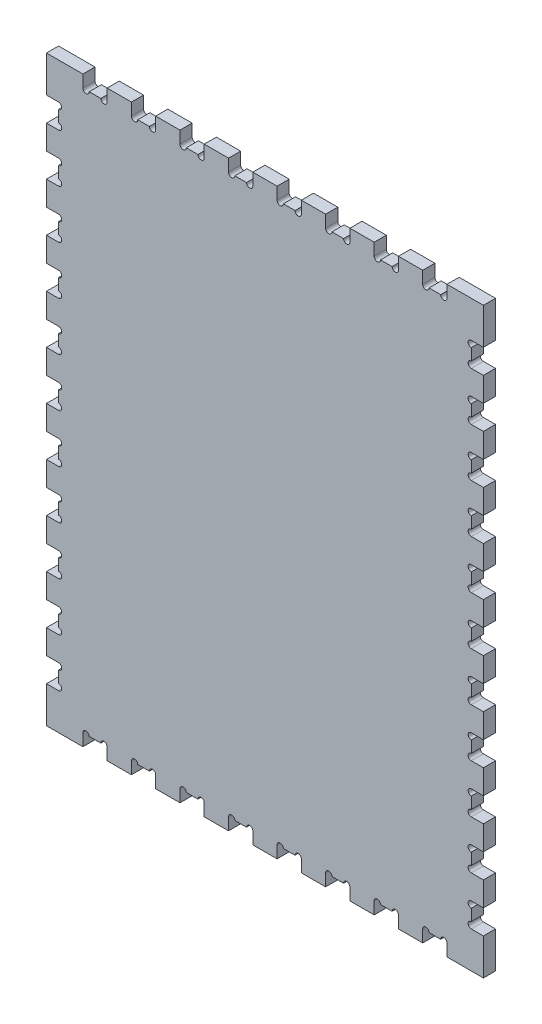
from build123d import *

# Parameters (mm, degrees)
SKETCH1_W             = 457.2
SKETCH1_H             = 609.6
BOSS_EXTRUDE1_DEPTH   = 12.7
CUT_EXTRUDE1_DEPTH    = 382.211607903
LPATTERN1_COUNT       = 8
LPATTERN1_PITCH       = 50.8
CUT_EXTRUDE2_DEPTH    = 382.211607903
LPATTERN2_COUNT       = 11
LPATTERN2_PITCH       = 50.8
MIRROR1_COPY_1_DEPTH  = 382.211607903
MIRROR1_COPY_2_DEPTH  = 382.211607903
MIRROR1_COPY_3_DEPTH  = 382.211607903
MIRROR1_COPY_4_DEPTH  = 382.211607903
MIRROR1_COPY_5_DEPTH  = 382.211607903
MIRROR1_COPY_6_DEPTH  = 382.211607903
MIRROR1_COPY_7_DEPTH  = 382.211607903
MIRROR1_COPY_8_DEPTH  = 382.211607903
MIRROR1_COPY_9_DEPTH  = 382.211607903
MIRROR1_COPY_10_DEPTH = 382.211607903
MIRROR1_COPY_11_DEPTH = 382.211607903
MIRROR2_COPY_1_DEPTH  = 382.211607903
MIRROR2_COPY_2_DEPTH  = 382.211607903
MIRROR2_COPY_3_DEPTH  = 382.211607903
MIRROR2_COPY_4_DEPTH  = 382.211607903
MIRROR2_COPY_5_DEPTH  = 382.211607903
MIRROR2_COPY_6_DEPTH  = 382.211607903
MIRROR2_COPY_7_DEPTH  = 382.211607903
MIRROR2_COPY_8_DEPTH  = 382.211607903


with BuildPart() as part:
    # Sketch1 → Boss-Extrude1 (new body)
    with BuildSketch(Plane.XY):
        Rectangle(SKETCH1_W, SKETCH1_H)
    extrude(amount=BOSS_EXTRUDE1_DEPTH)

    # Sketch2 → Cut-Extrude1 (cut, through all)
    with BuildSketch(Plane.XY.offset(12.7)):
        with BuildLine():
            Line((-165.1, 304.8), (-190.5, 304.8))
            Line((-190.5, 304.8), (-190.5, 292.1))
            ThreePointArc((-190.5, 292.1), (-187.198, 288.798), (-183.896, 292.1))
            Line((-183.896, 292.1), (-171.704, 292.1))
            ThreePointArc((-171.704, 292.1), (-168.402, 288.798), (-165.1, 292.1))
            Line((-165.1, 292.1), (-165.1, 304.8))
        make_face()
    cut_extrude1 = extrude(amount=-CUT_EXTRUDE1_DEPTH, mode=Mode.SUBTRACT)

    # LPattern1: Cut-Extrude1 ×8
    with Locations(*[(i * LPATTERN1_PITCH, 0, 0) for i in range(1, LPATTERN1_COUNT)]):
        add(cut_extrude1, mode=Mode.SUBTRACT)

    # Sketch3 → Cut-Extrude2 (cut, through all)
    with BuildSketch(Plane.XY.offset(12.7)):
        with BuildLine():
            Line((-215.9, 266.7), (-228.6, 266.7))
            Line((-228.6, 266.7), (-228.6, 241.3))
            Line((-228.6, 241.3), (-215.9, 241.3))
            ThreePointArc((-215.9, 241.3), (-212.598, 244.602), (-215.9, 247.904))
            Line((-215.9, 247.904), (-215.9, 260.096))
            ThreePointArc((-215.9, 260.096), (-212.598, 263.398), (-215.9, 266.7))
        make_face()
    cut_extrude2 = extrude(amount=-CUT_EXTRUDE2_DEPTH, mode=Mode.SUBTRACT)

    # LPattern2: Cut-Extrude2 ×11
    with Locations(*[(0, -i * LPATTERN2_PITCH, 0) for i in range(1, LPATTERN2_COUNT)]):
        add(cut_extrude2, mode=Mode.SUBTRACT)

    # Mirror1 copy 1 sketch → Mirror1 copy 1 (cut, through all)
    with BuildSketch(Plane(origin=(0, -50.8, 12.7), x_dir=(-1, 0, 0), z_dir=(0, 0, 1))):
        with BuildLine():
            Line((-215.9, -266.7), (-228.6, -266.7))
            Line((-228.6, -266.7), (-228.6, -241.3))
            Line((-228.6, -241.3), (-215.9, -241.3))
            ThreePointArc((-215.9, -241.3), (-212.598, -244.602), (-215.9, -247.904))
            Line((-215.9, -247.904), (-215.9, -260.096))
            ThreePointArc((-215.9, -260.096), (-212.598, -263.398), (-215.9, -266.7))
        make_face()
    extrude(amount=-MIRROR1_COPY_1_DEPTH, mode=Mode.SUBTRACT)

    # Mirror1 copy 2 sketch → Mirror1 copy 2 (cut, through all)
    with BuildSketch(Plane(origin=(0, -101.6, 12.7), x_dir=(-1, 0, 0), z_dir=(0, 0, 1))):
        with BuildLine():
            Line((-215.9, -266.7), (-228.6, -266.7))
            Line((-228.6, -266.7), (-228.6, -241.3))
            Line((-228.6, -241.3), (-215.9, -241.3))
            ThreePointArc((-215.9, -241.3), (-212.598, -244.602), (-215.9, -247.904))
            Line((-215.9, -247.904), (-215.9, -260.096))
            ThreePointArc((-215.9, -260.096), (-212.598, -263.398), (-215.9, -266.7))
        make_face()
    extrude(amount=-MIRROR1_COPY_2_DEPTH, mode=Mode.SUBTRACT)

    # Mirror1 copy 3 sketch → Mirror1 copy 3 (cut, through all)
    with BuildSketch(Plane(origin=(0, -152.4, 12.7), x_dir=(-1, 0, 0), z_dir=(0, 0, 1))):
        with BuildLine():
            Line((-215.9, -266.7), (-228.6, -266.7))
            Line((-228.6, -266.7), (-228.6, -241.3))
            Line((-228.6, -241.3), (-215.9, -241.3))
            ThreePointArc((-215.9, -241.3), (-212.598, -244.602), (-215.9, -247.904))
            Line((-215.9, -247.904), (-215.9, -260.096))
            ThreePointArc((-215.9, -260.096), (-212.598, -263.398), (-215.9, -266.7))
        make_face()
    extrude(amount=-MIRROR1_COPY_3_DEPTH, mode=Mode.SUBTRACT)

    # Mirror1 copy 4 sketch → Mirror1 copy 4 (cut, through all)
    with BuildSketch(Plane(origin=(0, -203.2, 12.7), x_dir=(-1, 0, 0), z_dir=(0, 0, 1))):
        with BuildLine():
            Line((-215.9, -266.7), (-228.6, -266.7))
            Line((-228.6, -266.7), (-228.6, -241.3))
            Line((-228.6, -241.3), (-215.9, -241.3))
            ThreePointArc((-215.9, -241.3), (-212.598, -244.602), (-215.9, -247.904))
            Line((-215.9, -247.904), (-215.9, -260.096))
            ThreePointArc((-215.9, -260.096), (-212.598, -263.398), (-215.9, -266.7))
        make_face()
    extrude(amount=-MIRROR1_COPY_4_DEPTH, mode=Mode.SUBTRACT)

    # Mirror1 copy 5 sketch → Mirror1 copy 5 (cut, through all)
    with BuildSketch(Plane(origin=(0, -254, 12.7), x_dir=(-1, 0, 0), z_dir=(0, 0, 1))):
        with BuildLine():
            Line((-215.9, -266.7), (-228.6, -266.7))
            Line((-228.6, -266.7), (-228.6, -241.3))
            Line((-228.6, -241.3), (-215.9, -241.3))
            ThreePointArc((-215.9, -241.3), (-212.598, -244.602), (-215.9, -247.904))
            Line((-215.9, -247.904), (-215.9, -260.096))
            ThreePointArc((-215.9, -260.096), (-212.598, -263.398), (-215.9, -266.7))
        make_face()
    extrude(amount=-MIRROR1_COPY_5_DEPTH, mode=Mode.SUBTRACT)

    # Mirror1 copy 6 sketch → Mirror1 copy 6 (cut, through all)
    with BuildSketch(Plane(origin=(0, -304.8, 12.7), x_dir=(-1, 0, 0), z_dir=(0, 0, 1))):
        with BuildLine():
            Line((-215.9, -266.7), (-228.6, -266.7))
            Line((-228.6, -266.7), (-228.6, -241.3))
            Line((-228.6, -241.3), (-215.9, -241.3))
            ThreePointArc((-215.9, -241.3), (-212.598, -244.602), (-215.9, -247.904))
            Line((-215.9, -247.904), (-215.9, -260.096))
            ThreePointArc((-215.9, -260.096), (-212.598, -263.398), (-215.9, -266.7))
        make_face()
    extrude(amount=-MIRROR1_COPY_6_DEPTH, mode=Mode.SUBTRACT)

    # Mirror1 copy 7 sketch → Mirror1 copy 7 (cut, through all)
    with BuildSketch(Plane(origin=(0, -355.6, 12.7), x_dir=(-1, 0, 0), z_dir=(0, 0, 1))):
        with BuildLine():
            Line((-215.9, -266.7), (-228.6, -266.7))
            Line((-228.6, -266.7), (-228.6, -241.3))
            Line((-228.6, -241.3), (-215.9, -241.3))
            ThreePointArc((-215.9, -241.3), (-212.598, -244.602), (-215.9, -247.904))
            Line((-215.9, -247.904), (-215.9, -260.096))
            ThreePointArc((-215.9, -260.096), (-212.598, -263.398), (-215.9, -266.7))
        make_face()
    extrude(amount=-MIRROR1_COPY_7_DEPTH, mode=Mode.SUBTRACT)

    # Mirror1 copy 8 sketch → Mirror1 copy 8 (cut, through all)
    with BuildSketch(Plane(origin=(0, -406.4, 12.7), x_dir=(-1, 0, 0), z_dir=(0, 0, 1))):
        with BuildLine():
            Line((-215.9, -266.7), (-228.6, -266.7))
            Line((-228.6, -266.7), (-228.6, -241.3))
            Line((-228.6, -241.3), (-215.9, -241.3))
            ThreePointArc((-215.9, -241.3), (-212.598, -244.602), (-215.9, -247.904))
            Line((-215.9, -247.904), (-215.9, -260.096))
            ThreePointArc((-215.9, -260.096), (-212.598, -263.398), (-215.9, -266.7))
        make_face()
    extrude(amount=-MIRROR1_COPY_8_DEPTH, mode=Mode.SUBTRACT)

    # Mirror1 copy 9 sketch → Mirror1 copy 9 (cut, through all)
    with BuildSketch(Plane(origin=(0, -457.2, 12.7), x_dir=(-1, 0, 0), z_dir=(0, 0, 1))):
        with BuildLine():
            Line((-215.9, -266.7), (-228.6, -266.7))
            Line((-228.6, -266.7), (-228.6, -241.3))
            Line((-228.6, -241.3), (-215.9, -241.3))
            ThreePointArc((-215.9, -241.3), (-212.598, -244.602), (-215.9, -247.904))
            Line((-215.9, -247.904), (-215.9, -260.096))
            ThreePointArc((-215.9, -260.096), (-212.598, -263.398), (-215.9, -266.7))
        make_face()
    extrude(amount=-MIRROR1_COPY_9_DEPTH, mode=Mode.SUBTRACT)

    # Mirror1 copy 10 sketch → Mirror1 copy 10 (cut, through all)
    with BuildSketch(Plane(origin=(0, -508, 12.7), x_dir=(-1, 0, 0), z_dir=(0, 0, 1))):
        with BuildLine():
            Line((-215.9, -266.7), (-228.6, -266.7))
            Line((-228.6, -266.7), (-228.6, -241.3))
            Line((-228.6, -241.3), (-215.9, -241.3))
            ThreePointArc((-215.9, -241.3), (-212.598, -244.602), (-215.9, -247.904))
            Line((-215.9, -247.904), (-215.9, -260.096))
            ThreePointArc((-215.9, -260.096), (-212.598, -263.398), (-215.9, -266.7))
        make_face()
    extrude(amount=-MIRROR1_COPY_10_DEPTH, mode=Mode.SUBTRACT)

    # Mirror1 copy 11 sketch → Mirror1 copy 11 (cut, through all)
    with BuildSketch(Plane(origin=(0, 0, 12.7), x_dir=(-1, 0, 0), z_dir=(0, 0, 1))):
        with BuildLine():
            Line((-215.9, -266.7), (-228.6, -266.7))
            Line((-228.6, -266.7), (-228.6, -241.3))
            Line((-228.6, -241.3), (-215.9, -241.3))
            ThreePointArc((-215.9, -241.3), (-212.598, -244.602), (-215.9, -247.904))
            Line((-215.9, -247.904), (-215.9, -260.096))
            ThreePointArc((-215.9, -260.096), (-212.598, -263.398), (-215.9, -266.7))
        make_face()
    extrude(amount=-MIRROR1_COPY_11_DEPTH, mode=Mode.SUBTRACT)

    # Mirror2 copy 1 sketch → Mirror2 copy 1 (cut, through all)
    with BuildSketch(Plane(origin=(50.8, 0, 12.7), x_dir=(1, 0, 0), z_dir=(0, 0, 1))):
        with BuildLine():
            Line((-165.1, -304.8), (-190.5, -304.8))
            Line((-190.5, -304.8), (-190.5, -292.1))
            ThreePointArc((-190.5, -292.1), (-187.198, -288.798), (-183.896, -292.1))
            Line((-183.896, -292.1), (-171.704, -292.1))
            ThreePointArc((-171.704, -292.1), (-168.402, -288.798), (-165.1, -292.1))
            Line((-165.1, -292.1), (-165.1, -304.8))
        make_face()
    extrude(amount=-MIRROR2_COPY_1_DEPTH, mode=Mode.SUBTRACT)

    # Mirror2 copy 2 sketch → Mirror2 copy 2 (cut, through all)
    with BuildSketch(Plane(origin=(101.6, 0, 12.7), x_dir=(1, 0, 0), z_dir=(0, 0, 1))):
        with BuildLine():
            Line((-165.1, -304.8), (-190.5, -304.8))
            Line((-190.5, -304.8), (-190.5, -292.1))
            ThreePointArc((-190.5, -292.1), (-187.198, -288.798), (-183.896, -292.1))
            Line((-183.896, -292.1), (-171.704, -292.1))
            ThreePointArc((-171.704, -292.1), (-168.402, -288.798), (-165.1, -292.1))
            Line((-165.1, -292.1), (-165.1, -304.8))
        make_face()
    extrude(amount=-MIRROR2_COPY_2_DEPTH, mode=Mode.SUBTRACT)

    # Mirror2 copy 3 sketch → Mirror2 copy 3 (cut, through all)
    with BuildSketch(Plane(origin=(152.4, 0, 12.7), x_dir=(1, 0, 0), z_dir=(0, 0, 1))):
        with BuildLine():
            Line((-165.1, -304.8), (-190.5, -304.8))
            Line((-190.5, -304.8), (-190.5, -292.1))
            ThreePointArc((-190.5, -292.1), (-187.198, -288.798), (-183.896, -292.1))
            Line((-183.896, -292.1), (-171.704, -292.1))
            ThreePointArc((-171.704, -292.1), (-168.402, -288.798), (-165.1, -292.1))
            Line((-165.1, -292.1), (-165.1, -304.8))
        make_face()
    extrude(amount=-MIRROR2_COPY_3_DEPTH, mode=Mode.SUBTRACT)

    # Mirror2 copy 4 sketch → Mirror2 copy 4 (cut, through all)
    with BuildSketch(Plane(origin=(203.2, 0, 12.7), x_dir=(1, 0, 0), z_dir=(0, 0, 1))):
        with BuildLine():
            Line((-165.1, -304.8), (-190.5, -304.8))
            Line((-190.5, -304.8), (-190.5, -292.1))
            ThreePointArc((-190.5, -292.1), (-187.198, -288.798), (-183.896, -292.1))
            Line((-183.896, -292.1), (-171.704, -292.1))
            ThreePointArc((-171.704, -292.1), (-168.402, -288.798), (-165.1, -292.1))
            Line((-165.1, -292.1), (-165.1, -304.8))
        make_face()
    extrude(amount=-MIRROR2_COPY_4_DEPTH, mode=Mode.SUBTRACT)

    # Mirror2 copy 5 sketch → Mirror2 copy 5 (cut, through all)
    with BuildSketch(Plane(origin=(254, 0, 12.7), x_dir=(1, 0, 0), z_dir=(0, 0, 1))):
        with BuildLine():
            Line((-165.1, -304.8), (-190.5, -304.8))
            Line((-190.5, -304.8), (-190.5, -292.1))
            ThreePointArc((-190.5, -292.1), (-187.198, -288.798), (-183.896, -292.1))
            Line((-183.896, -292.1), (-171.704, -292.1))
            ThreePointArc((-171.704, -292.1), (-168.402, -288.798), (-165.1, -292.1))
            Line((-165.1, -292.1), (-165.1, -304.8))
        make_face()
    extrude(amount=-MIRROR2_COPY_5_DEPTH, mode=Mode.SUBTRACT)

    # Mirror2 copy 6 sketch → Mirror2 copy 6 (cut, through all)
    with BuildSketch(Plane(origin=(304.8, 0, 12.7), x_dir=(1, 0, 0), z_dir=(0, 0, 1))):
        with BuildLine():
            Line((-165.1, -304.8), (-190.5, -304.8))
            Line((-190.5, -304.8), (-190.5, -292.1))
            ThreePointArc((-190.5, -292.1), (-187.198, -288.798), (-183.896, -292.1))
            Line((-183.896, -292.1), (-171.704, -292.1))
            ThreePointArc((-171.704, -292.1), (-168.402, -288.798), (-165.1, -292.1))
            Line((-165.1, -292.1), (-165.1, -304.8))
        make_face()
    extrude(amount=-MIRROR2_COPY_6_DEPTH, mode=Mode.SUBTRACT)

    # Mirror2 copy 7 sketch → Mirror2 copy 7 (cut, through all)
    with BuildSketch(Plane(origin=(355.6, 0, 12.7), x_dir=(1, 0, 0), z_dir=(0, 0, 1))):
        with BuildLine():
            Line((-165.1, -304.8), (-190.5, -304.8))
            Line((-190.5, -304.8), (-190.5, -292.1))
            ThreePointArc((-190.5, -292.1), (-187.198, -288.798), (-183.896, -292.1))
            Line((-183.896, -292.1), (-171.704, -292.1))
            ThreePointArc((-171.704, -292.1), (-168.402, -288.798), (-165.1, -292.1))
            Line((-165.1, -292.1), (-165.1, -304.8))
        make_face()
    extrude(amount=-MIRROR2_COPY_7_DEPTH, mode=Mode.SUBTRACT)

    # Mirror2 copy 8 sketch → Mirror2 copy 8 (cut, through all)
    with BuildSketch(Plane.XY.offset(12.7)):
        with BuildLine():
            Line((-165.1, -304.8), (-190.5, -304.8))
            Line((-190.5, -304.8), (-190.5, -292.1))
            ThreePointArc((-190.5, -292.1), (-187.198, -288.798), (-183.896, -292.1))
            Line((-183.896, -292.1), (-171.704, -292.1))
            ThreePointArc((-171.704, -292.1), (-168.402, -288.798), (-165.1, -292.1))
            Line((-165.1, -292.1), (-165.1, -304.8))
        make_face()
    extrude(amount=-MIRROR2_COPY_8_DEPTH, mode=Mode.SUBTRACT)


solid = part.part
